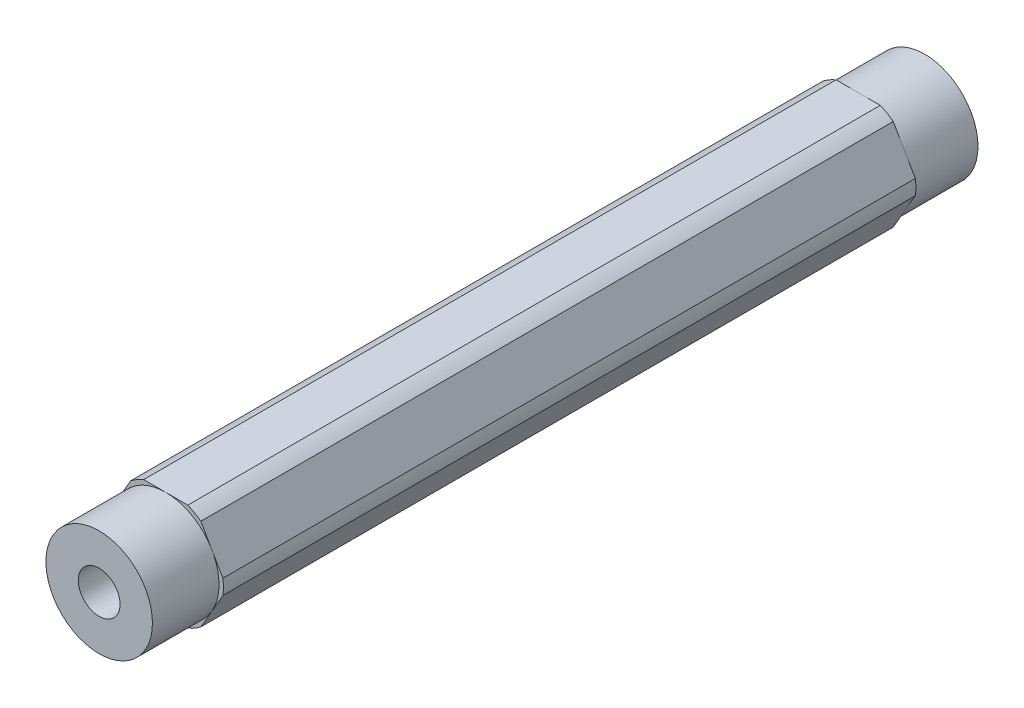
from build123d import *

# Parameters (mm, degrees)
SKETCH1_R           = 2.4892
BOSS_EXTRUDE1_DEPTH = 49.2125
SKETCH2_OUTSIDE_W   = 35.788
SKETCH2_OUTSIDE_H   = 34.738
SKETCH2_OUTSIDE_R   = 6.35
CUT_EXTRUDE1_DEPTH  = 7.9375


with BuildPart() as part:
    # Sketch1 → Boss-Extrude1 (new, symmetric)
    with BuildSketch(Plane.XY):
        with BuildLine():
            ThreePointArc((4.181770846, 5.456960429), (3.437499983, 5.953924622), (2.634980936, 6.35))
            Line((2.634980936, 6.35), (-2.634980936, 6.35))
            ThreePointArc((-2.634980936, 6.35), (-3.437499983, 5.953924622), (-4.181770846, 5.456960429))
            Line((-4.181770846, 5.456960429), (-6.816751782, 0.893039571))
            ThreePointArc((-6.816751782, 0.893039571), (-6.874999966, 0), (-6.816751782, -0.893039571))
            Line((-6.816751782, -0.893039571), (-4.181770846, -5.456960429))
            ThreePointArc((-4.181770846, -5.456960429), (-3.437499983, -5.953924622), (-2.634980936, -6.35))
            Line((-2.634980936, -6.35), (2.634980936, -6.35))
            ThreePointArc((2.634980936, -6.35), (3.437499983, -5.953924622), (4.181770846, -5.456960429))
            Line((4.181770846, -5.456960429), (6.816751782, -0.893039571))
            ThreePointArc((6.816751782, -0.893039571), (6.860422465, -0.447468582), (6.874999966, 0))
            ThreePointArc((6.874999966, 0), (6.860422465, 0.447468582), (6.816751782, 0.893039571))
            Line((6.816751782, 0.893039571), (4.181770846, 5.456960429))
        make_face()
        Circle(SKETCH1_R, mode=Mode.SUBTRACT)
    extrude(amount=BOSS_EXTRUDE1_DEPTH, both=True)

    # Sketch2 outside → Cut-Extrude1 (cut)
    with BuildSketch(Plane.XY.offset(49.2125)):
        Rectangle(SKETCH2_OUTSIDE_W, SKETCH2_OUTSIDE_H)
        Circle(SKETCH2_OUTSIDE_R, mode=Mode.SUBTRACT)
    cut_extrude1 = extrude(amount=-CUT_EXTRUDE1_DEPTH, mode=Mode.SUBTRACT)

    # Mirror1: Cut-Extrude1 across plane
    add(cut_extrude1.mirror(Plane.XY), mode=Mode.SUBTRACT)


solid = part.part
